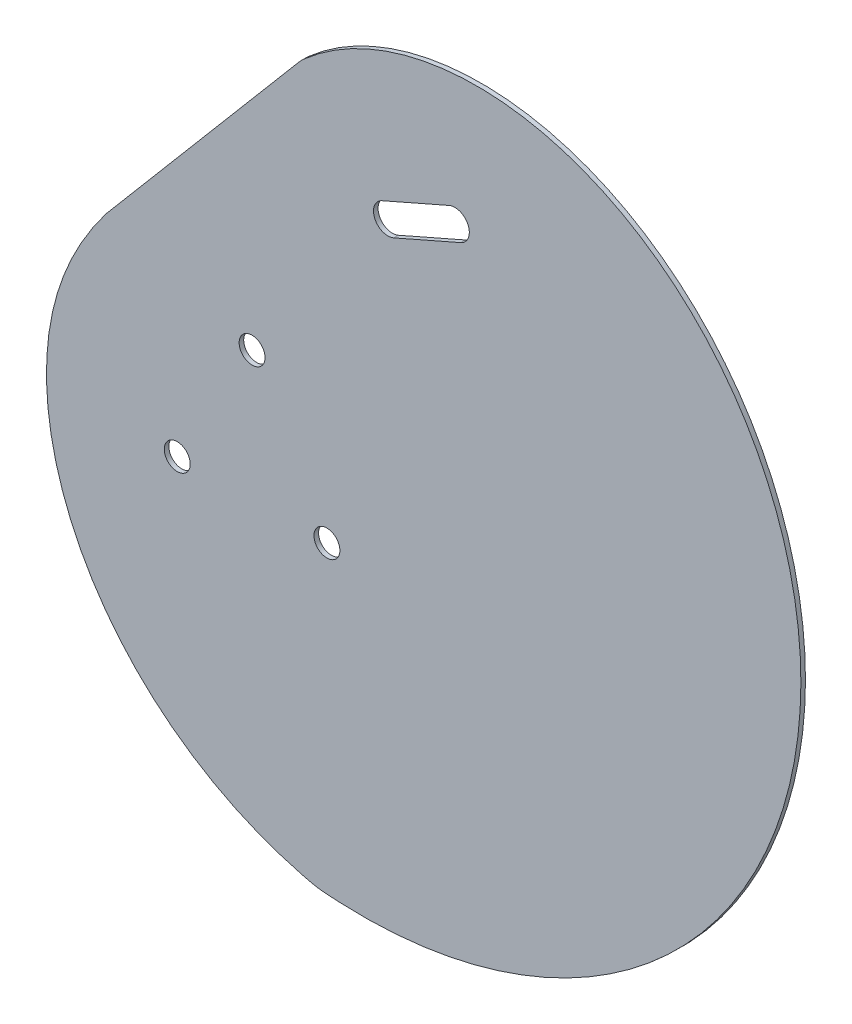
from build123d import *

# Parameters (mm, degrees)
BOSS_EXTRUDE1_START     = -0.396875
BOSS_EXTRUDE1_OUTLINE_R = 3.175
BOSS_EXTRUDE1_DEPTH     = 0.79375
CUT_EXTRUDE1_DEPTH      = 113.8252875
CUT_EXTRUDE1_DEPTH_BACK = 113.8252875
BOSS_EXTRUDE2_DEPTH     = 0.79375
M4_CLEARANCE_HOLE1_D    = 4.5
FILLET1_R               = 10
SKETCH7_W               = 13.91508681
SKETCH7_H               = 14.554044878
BOSS_EXTRUDE3_DEPTH     = 0.79375
CUT_EXTRUDE2_DEPTH      = 209.855679674


# Read off the part's stored shape, not the designer's step: Boss-Extrude1
with BuildPart() as part:
    # Boss-Extrude1 outline → Boss-Extrude1 (new body)
    with BuildSketch(Plane.XY.offset(BOSS_EXTRUDE1_START)):
        with BuildLine():
            add(Edge.make_bspline(
                [(-1.261284319, -76.388996664), (-0.976706936, -76.433000958), (-0.405700337, -76.500288673), (0.20528297, -76.543128655), (0.635947633, -76.565923488), (0.943803396, -76.583753699), (1.516577668, -76.625352645), (2.394728617, -76.679422652), (3.180819277, -76.713700374), (4.198037, -76.751687246), (6.052140639, -76.794272093), (8.655318967, -76.775789965), (11.799230285, -76.631186754), (14.930811608, -76.362150817), (19.092729282, -75.837698968), (24.252600304, -74.870904239), (30.336691794, -73.215166518), (38.249637718, -70.355302933), (47.664657668, -65.580710673), (57.878240574, -58.05265885), (69.647247229, -45.860449013), (80.17301629, -27.133451477), (84.253863041, -1.504791655), (79.559994743, 19.841206748), (70.879686514, 34.940163896), (62.021642873, 44.705365527), (51.090741107, 52.264081212), (38.576471747, 57.054085928), (25.100477493, 58.560382298), (13.770836895, 56.694329393), (5.225744009, 53.179291686), (-0.757485487, 49.527464518), (-5.179825642, 45.648133226), (-8.217128683, 42.311123306), (-10.283747679, 39.728556446), (-12.145398141, 37.129923022), (-13.803593656, 34.630220241), (-15.026366639, 32.787217268), (-15.757749026, 31.815043574), (-16.457283709, 31.008797547), (-17.314853043, 30.212425612), (-18.832098717, 29.140541156), (-20.579433545, 27.921014995), (-21.851448321, 26.952812158), (-22.922913486, 26.025576334), (-23.911333005, 25.095774574), (-25.043884789, 23.905717811), (-26.24444516, 22.476950142), (-27.667877154, 20.603207832), (-29.166272015, 18.381706059), (-30.682003525, 16.030489806), (-31.841745016, 14.323419156), (-32.792926522, 13.025871938), (-33.760991701, 11.771777118), (-35.193517942, 10.031827499), (-37.094774354, 7.688586111), (-39.650513176, 4.306101851), (-42.651423752, -0.366044153), (-45.535555759, -6.547251373), (-47.502970249, -13.211657775), (-48.684497464, -22.369909682), (-47.609886804, -33.732208724), (-42.864240814, -46.345132644), (-36.564129821, -55.468027352), (-30.429657579, -61.727526273), (-25.356811503, -65.867230195), (-20.797895182, -68.82985851), (-16.986888823, -70.897278381), (-14.057126153, -72.294062473), (-11.057489783, -73.537247471), (-8.528639781, -74.438248663), (-6.705355358, -75.008839512), (-5.69991862, -75.303300743), (-4.914663461, -75.525329661), (-4.043728169, -75.751750303), (-3.477018465, -75.89115289), (-3.15620306, -75.974687703), (-2.718728151, -76.089597955), (-2.113164636, -76.236262909), (-1.545861702, -76.34499237), (-1.261284319, -76.388996664)],
                knots=[0, 0, 0, 0, 0.000976562, 0.001953125, 0.002929688, 0.00390625, 0.005859375, 0.0078125, 0.009765625, 0.01171875, 0.015625, 0.0234375, 0.03125, 0.0390625, 0.046875, 0.0625, 0.078125, 0.09375, 0.125, 0.15625, 0.1875, 0.25, 0.3125, 0.375, 0.40625, 0.4375, 0.46875, 0.5, 0.53125, 0.5625, 0.578125, 0.59375, 0.609375, 0.6171875, 0.625, 0.6328125, 0.640625, 0.6484375, 0.65234375, 0.65625, 0.6640625, 0.671875, 0.67578125, 0.6796875, 0.681640625, 0.68359375, 0.6875, 0.69140625, 0.6953125, 0.703125, 0.7109375, 0.71875, 0.72265625, 0.7265625, 0.734375, 0.7421875, 0.75, 0.765625, 0.78125, 0.796875, 0.8125, 0.84375, 0.875, 0.90625, 0.921875, 0.9375, 0.953125, 0.9609375, 0.96875, 0.9765625, 0.984375, 0.98828125, 0.990234375, 0.9921875, 0.994140625, 0.99609375, 0.997070312, 0.998046875, 0.999023438, 1, 1, 1, 1], degree=3))
        make_face()
        Circle(BOSS_EXTRUDE1_OUTLINE_R, mode=Mode.SUBTRACT)
    extrude(amount=BOSS_EXTRUDE1_DEPTH)

    # Sketch2 → Cut-Extrude1 (cut, two sides: drawn at the far end of the back side and taken through both)
    with BuildSketch(Plane.XY.offset(-CUT_EXTRUDE1_DEPTH_BACK)):
        Polygon((-4.119310262, 46.506747557), (-37.979985712, 6.507923903), (-21.102439727, 46.506747557), align=None)
    extrude(amount=CUT_EXTRUDE1_DEPTH + CUT_EXTRUDE1_DEPTH_BACK, mode=Mode.SUBTRACT)

    # Sketch6 → Boss-Extrude2 (add)
    with BuildSketch(Plane.XY.offset(0.396875)):
        Polygon((-4.119310262, 46.506747557), (-18.797566669, 29.167666698), (-15.709388941, 26.553395222), (-1.031132534, 43.892476081), align=None)
    extrude(amount=-BOSS_EXTRUDE2_DEPTH)

    # M4 Clearance Hole1 (through all)
    with Locations(Plane.XY.offset(0.396875)):
        with Locations((-12.593900177, -1.272585975), (0.396480879, -23.772585975), (-25.584281234, -23.772585975)):
            Hole(M4_CLEARANCE_HOLE1_D / 2)

    # Fillet1
    fillet1_edges = [part.edges().sort_by_distance(p)[0] for p in [
        (-4.119310262, 46.506747557, 0),
    ]]
    fillet(fillet1_edges, radius=FILLET1_R)

    # Sketch7 → Boss-Extrude3 (add)
    with BuildSketch(Plane.XY.offset(0.396875)):
        with Locations((0.167886722, 0.454424986)):
            Rectangle(SKETCH7_W, SKETCH7_H)
    extrude(amount=-BOSS_EXTRUDE3_DEPTH)

    # Sketch9 → Cut-Extrude2 (cut, through all)
    with BuildSketch(Plane(origin=(-36.243419388, 94.915618056, -0.396875), x_dir=(-0.35672656878331593, 0.9342088391382743, 0), z_dir=(0, 0, 1))):
        with BuildLine():
            Line((-79.814896425, -21.147562089), (-79.196769607, -33.83251062))
            ThreePointArc((-79.196769607, -33.83251062), (-76.578053987, -36.207869225), (-74.202695382, -33.589153605))
            Line((-74.202695382, -33.589153605), (-74.8208222, -20.904205074))
            ThreePointArc((-74.8208222, -20.904205074), (-77.43953782, -18.528846469), (-79.814896425, -21.147562089))
        make_face()
    extrude(amount=CUT_EXTRUDE2_DEPTH, mode=Mode.SUBTRACT)


solid = part.part
